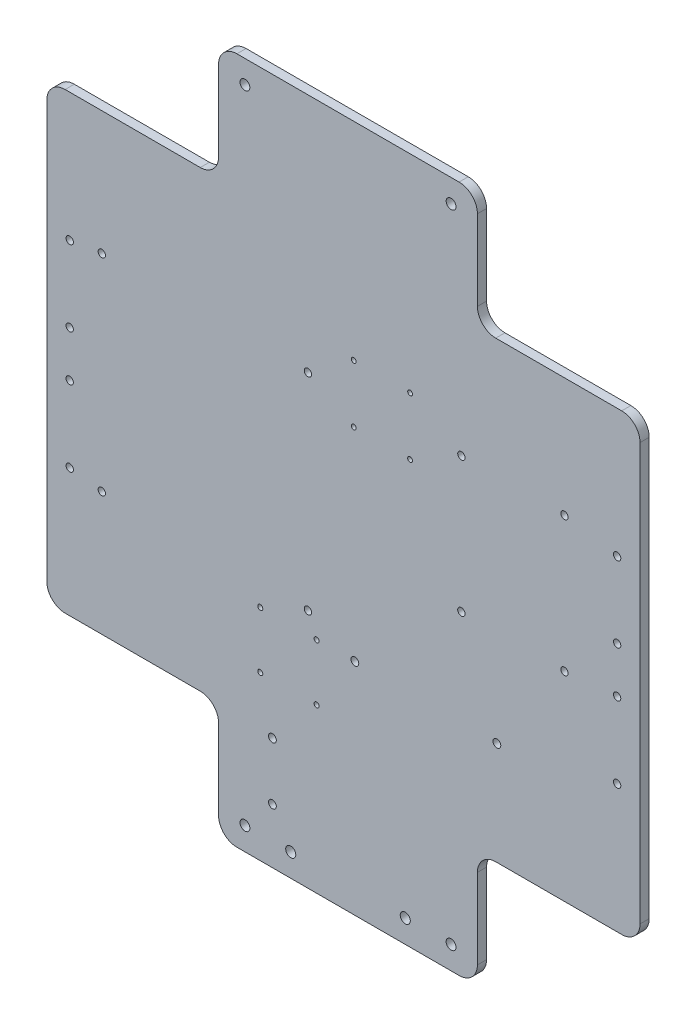
from build123d import *

# Parameters (mm, degrees)
SKETCH_281X300_25_R                    = 2.15
SKETCH_281X300_25_R_2                  = 2.2
SKETCH_281X300_25_R_3                  = 1.6
SKETCH_281X300_25_R_4                  = 1.05
F_4MM_DEPTH                            = 4
FILLET_1_R                             = 8
ELECTRONICS_4X_D3P4_ISO273_OUTLINE_R   = 1.1
ELECTRONICS_4X_D3P4_ISO273_OUTLINE_R_2 = 1.7
ELECTRONICS_4X_D3P4_ISO273_DEPTH       = 4


# Read off the part's stored shape, not the designer's step: Electronics_4x_D3p4_ISO273
with BuildPart() as part:
    # 底板轮廓_281x300_安装孔外移25 → 凸台拉伸_4mm (new body)
    with BuildSketch(Plane.XY):
        Polygon((-55.5, 150), (-55.5, 99), (-130.5, 99), (-130.5, 57), (-130.5, -57), (-130.5, -99), (-55.5, -99), (-55.5, -150), (57.5, -150), (57.5, -99), (128.5, -99), (128.5, -57), (128.5, 57), (128.5, 99), (57.5, 99), (57.5, 150), align=None)
        with Locations((-44, 140)):
            Circle(SKETCH_281X300_25_R, mode=Mode.SUBTRACT)
        with Locations((26, -140)):
            Circle(SKETCH_281X300_25_R_2, mode=Mode.SUBTRACT)
        with Locations((-24, -140)):
            Circle(SKETCH_281X300_25_R_2, mode=Mode.SUBTRACT)
        with Locations((118.5, 10)):
            Circle(SKETCH_281X300_25_R_3, mode=Mode.SUBTRACT)
        with Locations((118.5, -10)):
            Circle(SKETCH_281X300_25_R_3, mode=Mode.SUBTRACT)
        with Locations((-120.5, 10)):
            Circle(SKETCH_281X300_25_R_3, mode=Mode.SUBTRACT)
        with Locations((-120.5, -10)):
            Circle(SKETCH_281X300_25_R_3, mode=Mode.SUBTRACT)
        with Locations((118.5, 43)):
            Circle(SKETCH_281X300_25_R_3, mode=Mode.SUBTRACT)
        with Locations((118.5, -43)):
            Circle(SKETCH_281X300_25_R_3, mode=Mode.SUBTRACT)
        with Locations((-120.5, 43)):
            Circle(SKETCH_281X300_25_R_3, mode=Mode.SUBTRACT)
        with Locations((-120.5, -43)):
            Circle(SKETCH_281X300_25_R_3, mode=Mode.SUBTRACT)
        with Locations((46, 140)):
            Circle(SKETCH_281X300_25_R, mode=Mode.SUBTRACT)
        with Locations((-44, -140)):
            Circle(SKETCH_281X300_25_R, mode=Mode.SUBTRACT)
        with Locations((46, -140)):
            Circle(SKETCH_281X300_25_R, mode=Mode.SUBTRACT)
        with Locations((-16.5, -45)):
            Circle(SKETCH_281X300_25_R_3, mode=Mode.SUBTRACT)
        with Locations((-106.5, -45)):
            Circle(SKETCH_281X300_25_R_3, mode=Mode.SUBTRACT)
        with Locations((-106.5, 45)):
            Circle(SKETCH_281X300_25_R_3, mode=Mode.SUBTRACT)
        with Locations((-16.5, 45)):
            Circle(SKETCH_281X300_25_R_3, mode=Mode.SUBTRACT)
        with Locations((50.5, -12)):
            Circle(SKETCH_281X300_25_R_3, mode=Mode.SUBTRACT)
        with Locations((95.5, -12)):
            Circle(SKETCH_281X300_25_R_3, mode=Mode.SUBTRACT)
        with Locations((50.5, 47)):
            Circle(SKETCH_281X300_25_R_3, mode=Mode.SUBTRACT)
        with Locations((95.5, 47)):
            Circle(SKETCH_281X300_25_R_3, mode=Mode.SUBTRACT)
        with Locations((3.5, 34.4)):
            Circle(SKETCH_281X300_25_R_4, mode=Mode.SUBTRACT)
        with Locations((28.1, 34.4)):
            Circle(SKETCH_281X300_25_R_4, mode=Mode.SUBTRACT)
        with Locations((3.5, 59.6)):
            Circle(SKETCH_281X300_25_R_4, mode=Mode.SUBTRACT)
        with Locations((28.1, 59.6)):
            Circle(SKETCH_281X300_25_R_4, mode=Mode.SUBTRACT)
    extrude(amount=F_4MM_DEPTH)

    # 圆角1
    fillet_1_edges = [part.edges().sort_by_distance(p)[0] for p in [
        (-130.5, 99, 2),
        (-55.5, 99, 2),
        (-55.5, 150, 2),
        (57.5, 150, 2),
        (57.5, 99, 2),
        (128.5, 99, 2),
        (128.5, -99, 2),
        (57.5, -99, 2),
        (57.5, -150, 2),
        (-55.5, -150, 2),
        (-55.5, -99, 2),
        (-130.5, -99, 2),
    ]]
    fillet(fillet_1_edges, radius=FILLET_1_R)

    # Electronics_4x_D3p4_ISO273 outline → Electronics_4x_D3p4_ISO273 (cut)
    with BuildSketch(Plane.XY):
        with Locations((-37.3, -78.8)):
            Circle(ELECTRONICS_4X_D3P4_ISO273_OUTLINE_R)
        with Locations((66, -54)):
            Circle(ELECTRONICS_4X_D3P4_ISO273_OUTLINE_R_2)
        with Locations((4, -54)):
            Circle(ELECTRONICS_4X_D3P4_ISO273_OUTLINE_R_2)
        with Locations((-32, -101)):
            Circle(ELECTRONICS_4X_D3P4_ISO273_OUTLINE_R_2)
        with Locations((-12.7, -54.2)):
            Circle(ELECTRONICS_4X_D3P4_ISO273_OUTLINE_R)
        with Locations((-12.7, -78.8)):
            Circle(ELECTRONICS_4X_D3P4_ISO273_OUTLINE_R)
        with Locations((-37.3, -54.2)):
            Circle(ELECTRONICS_4X_D3P4_ISO273_OUTLINE_R)
        with Locations((-32, -126)):
            Circle(ELECTRONICS_4X_D3P4_ISO273_OUTLINE_R_2)
    extrude(amount=ELECTRONICS_4X_D3P4_ISO273_DEPTH, mode=Mode.SUBTRACT)


solid = part.part
